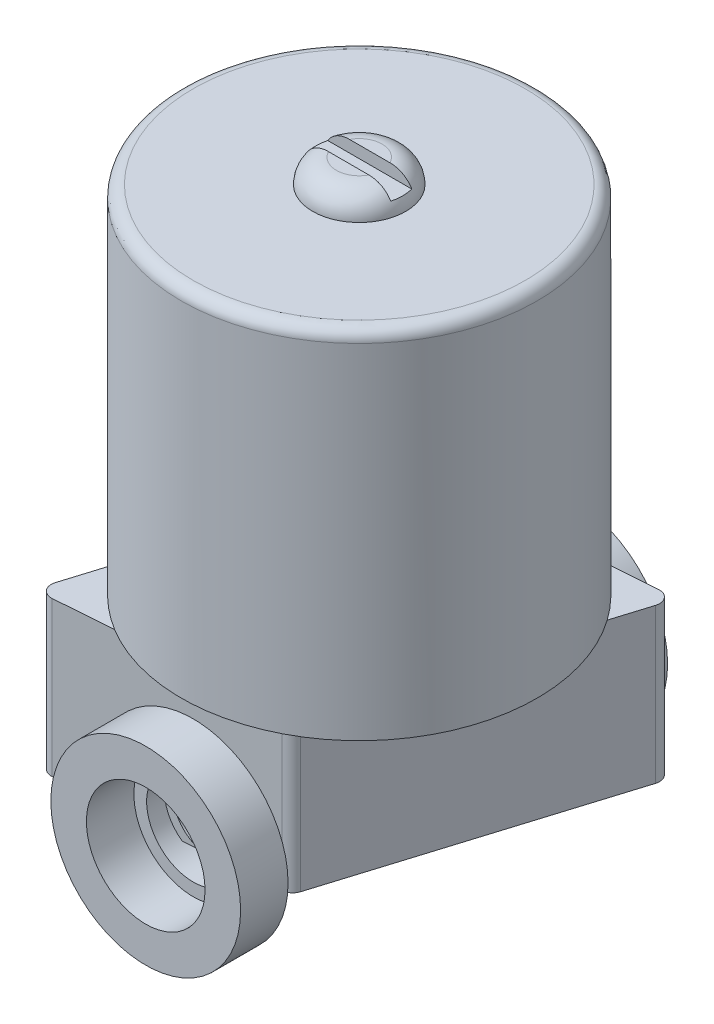
from build123d import *

# Parameters (mm, degrees)
SKETCH1_R           = 15
BOSS_EXTRUDE1_DEPTH = 30
SKETCH2_R           = 2.5
BOSS_EXTRUDE2_DEPTH = 13
SKETCH3_R           = 5
SKETCH3_R_2         = 3.92199541
BOSS_EXTRUDE3_DEPTH = 28
SKETCH4_R           = 3.213422936
CUT_EXTRUDE1_DEPTH  = 45.339598555
FILLET2_R           = 1
SKETCH5_R           = 8
SKETCH5_R_2         = 5
BOSS_EXTRUDE4_DEPTH = 4
SKETCH6_R           = 8
SKETCH6_R_2         = 5
BOSS_EXTRUDE6_DEPTH = 4
SKETCH8_R           = 3.922583836
BOSS_EXTRUDE7_DEPTH = 2
FILLET3_R           = 2
SKETCH9_W           = 8.867784407
SKETCH9_H           = 1.779822502
CUT_EXTRUDE3_DEPTH  = 1


with BuildPart() as part:
    # Sketch1 → Boss-Extrude1 (new body)
    with BuildSketch(Plane(origin=(0, 0, 0), x_dir=(1, 0, 0), z_dir=(0, 1, 0))):
        with Locations(Location((0, 0, 0), (0, 0, 270))):
            Circle(SKETCH1_R)
    extrude(amount=BOSS_EXTRUDE1_DEPTH)

    # Sketch2 → Boss-Extrude2 (add)
    with BuildSketch(Plane.XZ):
        with BuildLine():
            Line((-12.718406511, 13.165617512), (5.282689871, 11.805772831))
            ThreePointArc((5.282689871, 11.805772831), (5.831177604, 11.59018569), (6.163003877, 11.10314572))
            Line((6.163003877, 11.10314572), (13.211347203, -11.766006614))
            ThreePointArc((13.211347203, -11.766006614), (13.037277191, -12.684353766), (12.180377802, -13.057697169))
            Line((12.180377802, -13.057697169), (-5.82071858, -11.697852488))
            ThreePointArc((-5.82071858, -11.697852488), (-6.369206312, -11.482265347), (-6.701032586, -10.995225377))
            Line((-6.701032586, -10.995225377), (-13.749375911, 11.873926957))
            ThreePointArc((-13.749375911, 11.873926957), (-13.5753059, 12.792274109), (-12.718406511, 13.165617512))
        make_face()
        with Locations(Location((-7.778174593, 7.778174593, 0), (0, 0, 270))):
            Circle(SKETCH2_R, mode=Mode.SUBTRACT)
        with Locations(Location((7.778174593, -7.778174593, 0), (0, 0, 270))):
            Circle(SKETCH2_R, mode=Mode.SUBTRACT)
    extrude(amount=BOSS_EXTRUDE2_DEPTH)

    # Sketch3 → Boss-Extrude3 (add)
    with BuildSketch(Plane.XY.offset(14)):
        with Locations((0, -10)):
            Circle(SKETCH3_R)
        with Locations((0, -10)):
            Circle(SKETCH3_R_2, mode=Mode.SUBTRACT)
    extrude(amount=-BOSS_EXTRUDE3_DEPTH)

    # Sketch4 → Cut-Extrude1 (cut, through all)
    with BuildSketch(Plane.XY.offset(14)):
        with Locations((0, -10)):
            Circle(SKETCH4_R)
    extrude(amount=-CUT_EXTRUDE1_DEPTH, mode=Mode.SUBTRACT)

    # Fillet2
    fillet2_edges = [part.edges().sort_by_distance(p)[0] for p in [
        (0, 30, -15),
    ]]
    fillet(fillet2_edges, radius=FILLET2_R)

    # Sketch8 → Boss-Extrude7 (add)
    with BuildSketch(Plane(origin=(0, 30, 0), x_dir=(1, 0, 0), z_dir=(0, 1, 0))):
        with Locations(Location((0, 0, 0), (0, 0, 270))):
            Circle(SKETCH8_R)
    extrude(amount=BOSS_EXTRUDE7_DEPTH)

    # Fillet3
    fillet3_edges = [part.edges().sort_by_distance(p)[0] for p in [
        (0, 32, -3.922583836),
    ]]
    fillet(fillet3_edges, radius=FILLET3_R - 0.0001)  # a hair under: the kernel refuses the full size

    # Sketch9 → Cut-Extrude3 (cut)
    with BuildSketch(Plane(origin=(0, 32, 0), x_dir=(1, 0, 0), z_dir=(0, 1, 0))):
        with Locations((-0.068002485, 0)):
            Rectangle(SKETCH9_W, SKETCH9_H)
    extrude(amount=-CUT_EXTRUDE3_DEPTH, mode=Mode.SUBTRACT)


with BuildPart() as body_2:
    # Sketch5 → Boss-Extrude4 (new body)
    with BuildSketch(Plane(origin=(0, 0, -14), x_dir=(-1, 0, 0), z_dir=(0, 0, -1))):
        with Locations((0, -10)):
            Circle(SKETCH5_R)
        with Locations((0, -10)):
            Circle(SKETCH5_R_2, mode=Mode.SUBTRACT)
    extrude(amount=BOSS_EXTRUDE4_DEPTH)


with BuildPart() as body_3:
    # Sketch6 → Boss-Extrude6 (new body)
    with BuildSketch(Plane.XY.offset(14)):
        with Locations((0, -10)):
            Circle(SKETCH6_R)
        with Locations((0, -10)):
            Circle(SKETCH6_R_2, mode=Mode.SUBTRACT)
    extrude(amount=BOSS_EXTRUDE6_DEPTH)


solid = Compound([part.part, body_2.part, body_3.part])
